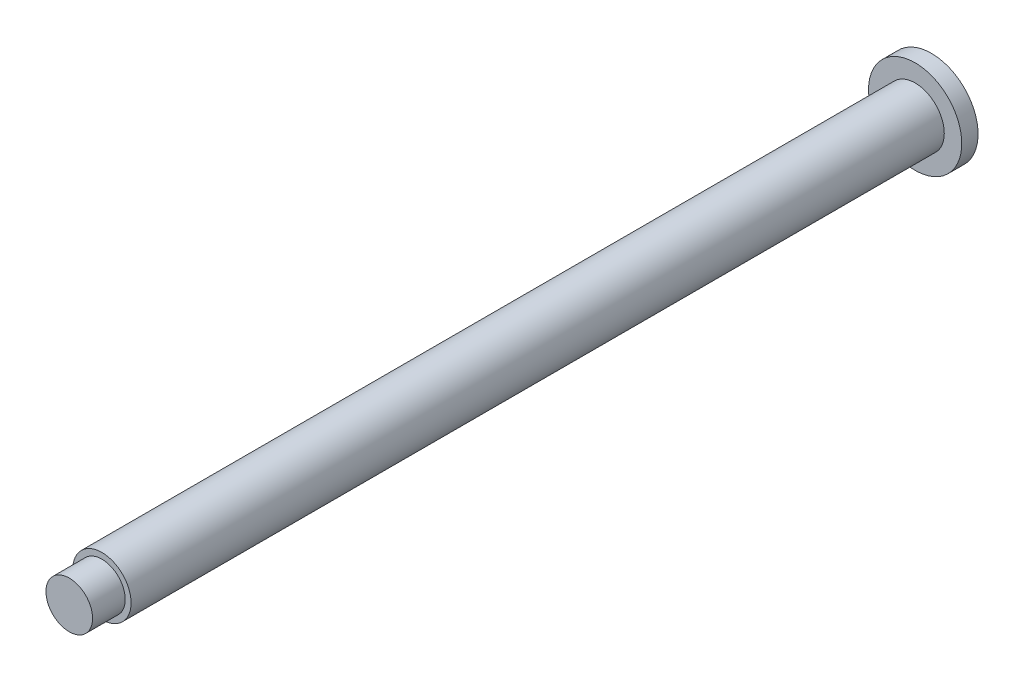
from build123d import *

# Parameters (mm, degrees)
SKETCH1_R           = 2.5
BOSS_EXTRUDE1_DEPTH = 69.75
SKETCH2_R           = 4
BOSS_EXTRUDE2_DEPTH = 1.4
SKETCH3_R           = 2.05
CUT_EXTRUDE1_DEPTH  = 3
SKETCH4_R           = 2
BOSS_EXTRUDE3_DEPTH = 2.8


with BuildPart() as part:
    # Sketch1 → Boss-Extrude1 (new body)
    with BuildSketch(Plane(origin=(0, 0, 0), x_dir=(0, 1, 0), z_dir=(0, 0, 1))):
        Circle(SKETCH1_R)
    extrude(amount=BOSS_EXTRUDE1_DEPTH)

    # Sketch2 → Boss-Extrude2 (add)
    with BuildSketch(Plane(origin=(0, 0, 0), x_dir=(1, 0, 0), z_dir=(0, 0, -1))):
        Circle(SKETCH2_R)
    extrude(amount=BOSS_EXTRUDE2_DEPTH)

    # Sketch3 → Cut-Extrude1 (cut)
    with BuildSketch(Plane(origin=(0, 0, -1.4), x_dir=(1, 0, 0), z_dir=(0, 0, -1))):
        Circle(SKETCH3_R)
    extrude(amount=-CUT_EXTRUDE1_DEPTH, mode=Mode.SUBTRACT)

    # Sketch4 → Boss-Extrude3 (add)
    with BuildSketch(Plane.XY.offset(69.75)):
        Circle(SKETCH4_R)
    extrude(amount=BOSS_EXTRUDE3_DEPTH)


solid = part.part
